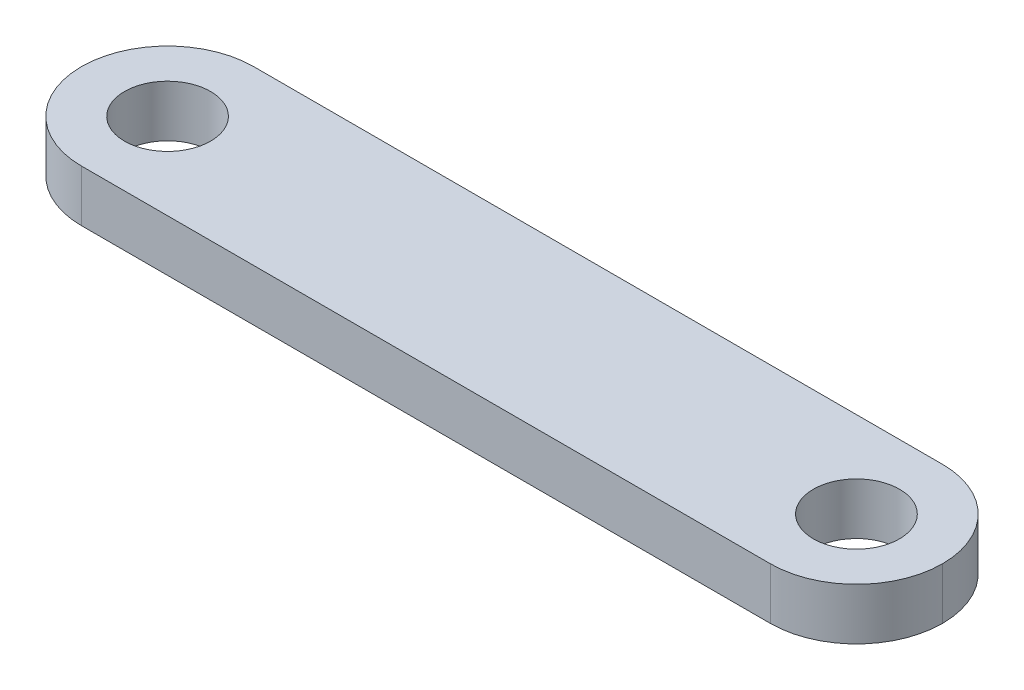
from build123d import *

# Parameters (mm, degrees)
SKETCH1_W           = 100
SKETCH1_H           = 20
BOSS_EXTRUDE1_DEPTH = 6
FILLET1_R           = 10
SKETCH2_R           = 5
CUT_EXTRUDE1_DEPTH  = 103.156742313


with BuildPart() as part:
    # Sketch1 → Boss-Extrude1 (new body)
    with BuildSketch(Plane(origin=(0, 0, 0), x_dir=(1, 0, 0), z_dir=(0, 1, 0))):
        with Locations((50, 10)):
            Rectangle(SKETCH1_W, SKETCH1_H)
    extrude(amount=BOSS_EXTRUDE1_DEPTH)

    # Fillet1
    fillet1_edges = [part.edges().sort_by_distance(p)[0] for p in [
        (100, 3, -20),
        (100, 3, 0),
        (0, 3, -20),
        (0, 3, 0),
    ]]
    fillet(fillet1_edges, radius=FILLET1_R - 0.0001)  # a hair under: the kernel refuses the full size

    # Sketch2 → Cut-Extrude1 (cut, through all)
    with BuildSketch(Plane(origin=(0, 6, 0), x_dir=(1, 0, 0), z_dir=(0, 1, 0))):
        with Locations(Location((10, 10, 0), (0, 0, 270))):
            Circle(SKETCH2_R)
        with Locations(Location((90, 10, 0), (0, 0, 270))):
            Circle(SKETCH2_R)
    extrude(amount=-CUT_EXTRUDE1_DEPTH, mode=Mode.SUBTRACT)


solid = part.part
